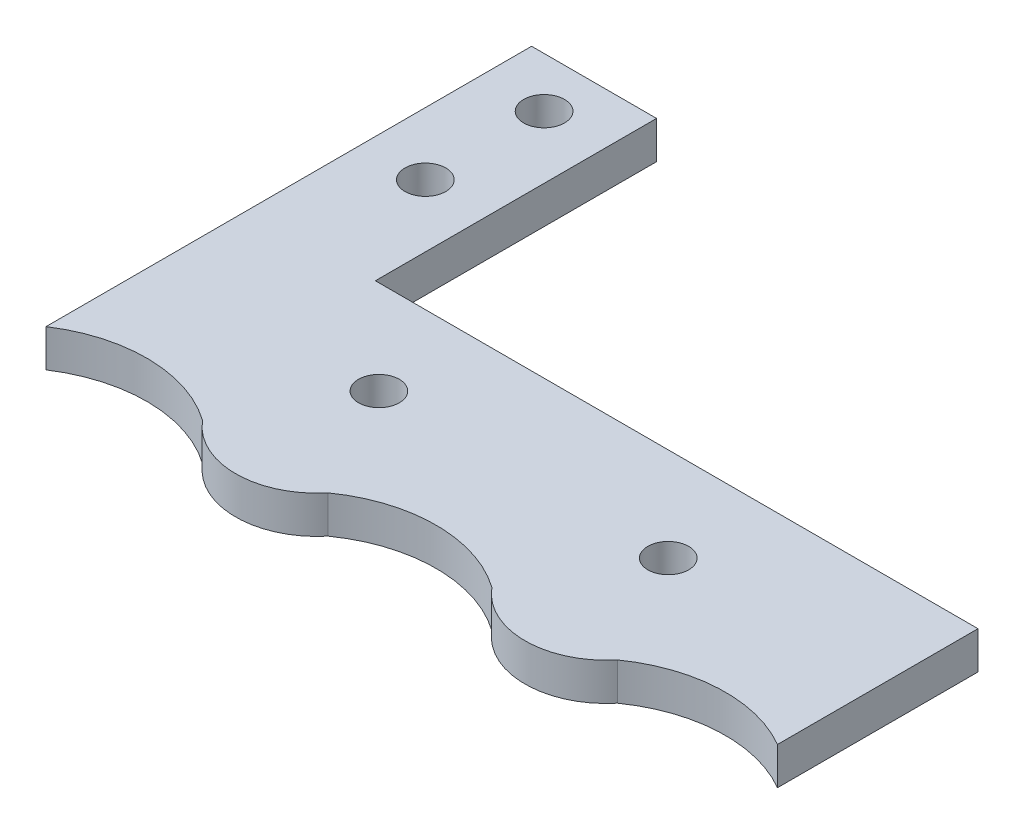
from build123d import *

# Parameters (mm, degrees)
BASE_FLANGE1_DEPTH        = 3
SKETCH8_R                 = 1.635
CUT_EXTRUDE1_DEPTH        = 3
F_4_CLEARANCE_HOLE2_D     = 3.2639
F_4_CLEARANCE_HOLE2_DEPTH = 3
F_4_CLEARANCE_HOLE2_TIP   = 0.980574487
CUT_EXTRUDE2_DEPTH        = 3


# Sheet-metal steps are written as plain solids
with BuildPart() as part:
    # Sketch3 → Base-Flange1 (new body)
    with BuildSketch(Plane(origin=(0, 0, 0), x_dir=(1, 0, 0), z_dir=(0, 1, 0))):
        with BuildLine():
            Line((-29.358964924, 8.867320879), (-29.358964924, 25.825))
            Line((-29.358964924, 25.825), (-29.358964924, 48.325))
            Line((-29.358964924, 48.325), (-19.358964924, 48.325))
            Line((-19.358964924, 48.325), (-19.358964924, 25.825))
            Line((-19.358964924, 25.825), (29.358964924, 25.825))
            Line((29.358964924, 25.825), (29.358964924, 8.867320879))
            ThreePointArc((29.358964924, 8.867320879), (23.15, 10.825), (16.941035076, 8.867320879))
            ThreePointArc((16.941035076, 8.867320879), (11.575, 6.362392354), (6.208964924, 8.867320879))
            ThreePointArc((6.208964924, 8.867320879), (0, 10.825), (-6.208964924, 8.867320879))
            ThreePointArc((-6.208964924, 8.867320879), (-11.575, 6.362392354), (-16.941035076, 8.867320879))
            ThreePointArc((-16.941035076, 8.867320879), (-23.15, 10.825), (-29.358964924, 8.867320879))
        make_face()
    extrude(amount=-BASE_FLANGE1_DEPTH)

    # Sketch8 → Cut-Extrude1 (cut)
    with BuildSketch(Plane(origin=(0, 0, 0), x_dir=(1, 0, 0), z_dir=(0, 1, 0))):
        with Locations(Location((-24.358964924, 44.325, 0), (0, 0, 270))):
            Circle(SKETCH8_R)
        with Locations(Location((-24.358964924, 34.825, 0), (0, 0, 270))):
            Circle(SKETCH8_R)
    extrude(amount=-CUT_EXTRUDE1_DEPTH, mode=Mode.SUBTRACT)

    # #4 Clearance Hole2
    with Locations(Plane.XZ.offset(3)):
        with Locations((11.575, -18.325), (-11.575, -18.325)):
            Hole(F_4_CLEARANCE_HOLE2_D / 2, depth=F_4_CLEARANCE_HOLE2_DEPTH)
            with Locations((0, 0, -(F_4_CLEARANCE_HOLE2_DEPTH + F_4_CLEARANCE_HOLE2_TIP / 2))):  # 118° drill point
                Cone(0, F_4_CLEARANCE_HOLE2_D / 2, F_4_CLEARANCE_HOLE2_TIP, mode=Mode.SUBTRACT)

    # Sketch11 → Cut-Extrude2 (cut)
    with BuildSketch(Plane.XZ.offset(3)):
        with BuildLine():
            Line((-29.645753142, -9.276896902), (-29.645753142, -3.891418545))
            Line((-29.645753142, -3.891418545), (33.433786827, -3.891418545))
            Line((33.433786827, -3.891418545), (33.433786827, -25.825))
            Line((33.433786827, -25.825), (28.858964924, -25.825))
            Line((28.858964924, -25.825), (28.858964924, -9.780764004))
            ThreePointArc((28.858964924, -9.780764004), (22.648874034, -11.313907272), (16.598650974, -9.237718925))
            ThreePointArc((16.598650974, -9.237718925), (11.575, -6.862392354), (6.551349026, -9.237718925))
            ThreePointArc((6.551349026, -9.237718925), (0, -11.325), (-6.551349026, -9.237718925))
            ThreePointArc((-6.551349026, -9.237718925), (-11.575, -6.862392354), (-16.598650974, -9.237718925))
            ThreePointArc((-16.598650974, -9.237718925), (-23.115993323, -11.324948942), (-29.645753142, -9.276896902))
        make_face()
    extrude(amount=-CUT_EXTRUDE2_DEPTH, mode=Mode.SUBTRACT)


solid = part.part
